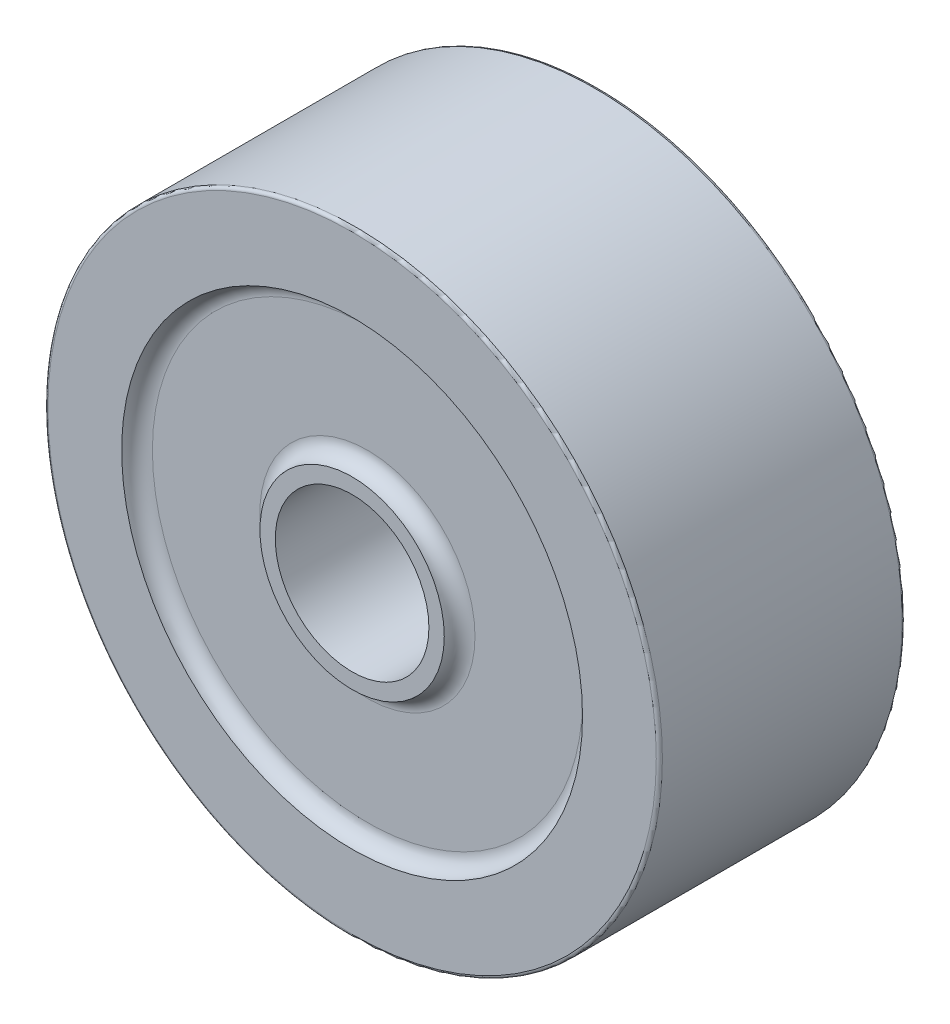
from build123d import *

# Parameters (mm, degrees)
SKETCH3_R          = 6.35
CUT_EXTRUDE1_DEPTH = 42.270115096
FILLET1_R          = 1.27
FILLET2_R          = 0.254
SKETCH4_W          = 12.7
SKETCH4_H          = 12.7
CUT_EXTRUDE2_DEPTH = 5.08


with BuildPart() as part:
    # Sketch2 → Revolve1 (revolve)
    with BuildSketch(Plane(origin=(0, 0, 0), x_dir=(0, 0, -1), z_dir=(1, 0, 0)), mode=Mode.PRIVATE) as revolve1_sk:
        Polygon((0, -7.62), (1.27, -7.62), (1.27, -19.05), (0, -19.05), (0, -25.4), (20.32, -25.4), (20.32, -19.05), (19.05, -19.05), (19.05, -11.43), (20.32, -11.43), (20.32, 0), (0, 0), align=None)
    revolve(revolve1_sk.sketch.rotate(Axis((0, 0, 0), (0, 0, -1)), 270), axis=Axis((0, 0, 0), (0, 0, -1)))

    # Sketch3 → Cut-Extrude1 (cut, through all)
    with BuildSketch(Plane.XY):
        Circle(SKETCH3_R)
    extrude(amount=-CUT_EXTRUDE1_DEPTH, mode=Mode.SUBTRACT)

    # Fillet1
    fillet1_edges = [part.edges().sort_by_distance(p)[0] for p in [
        (-19.05, 0, -19.05),
        (-19.05, 0, -1.27),
        (-7.62, 0, -1.27),
        (-11.43, 0, -19.05),
    ]]
    fillet(fillet1_edges, radius=FILLET1_R - 0.0001)  # a hair under: the kernel refuses the full size

    # Fillet2
    fillet2_edges = [part.edges().sort_by_distance(p)[0] for p in [
        (-25.4, 0, -20.32),
        (-25.4, 0, 0),
    ]]
    fillet(fillet2_edges, radius=FILLET2_R)

    # Sketch4 → Cut-Extrude2 (cut)
    with BuildSketch(Plane(origin=(0, 0, -20.32), x_dir=(-1, 0, 0), z_dir=(0, 0, -1))):
        Rectangle(SKETCH4_W, SKETCH4_H)
    extrude(amount=-CUT_EXTRUDE2_DEPTH, mode=Mode.SUBTRACT)


solid = part.part
